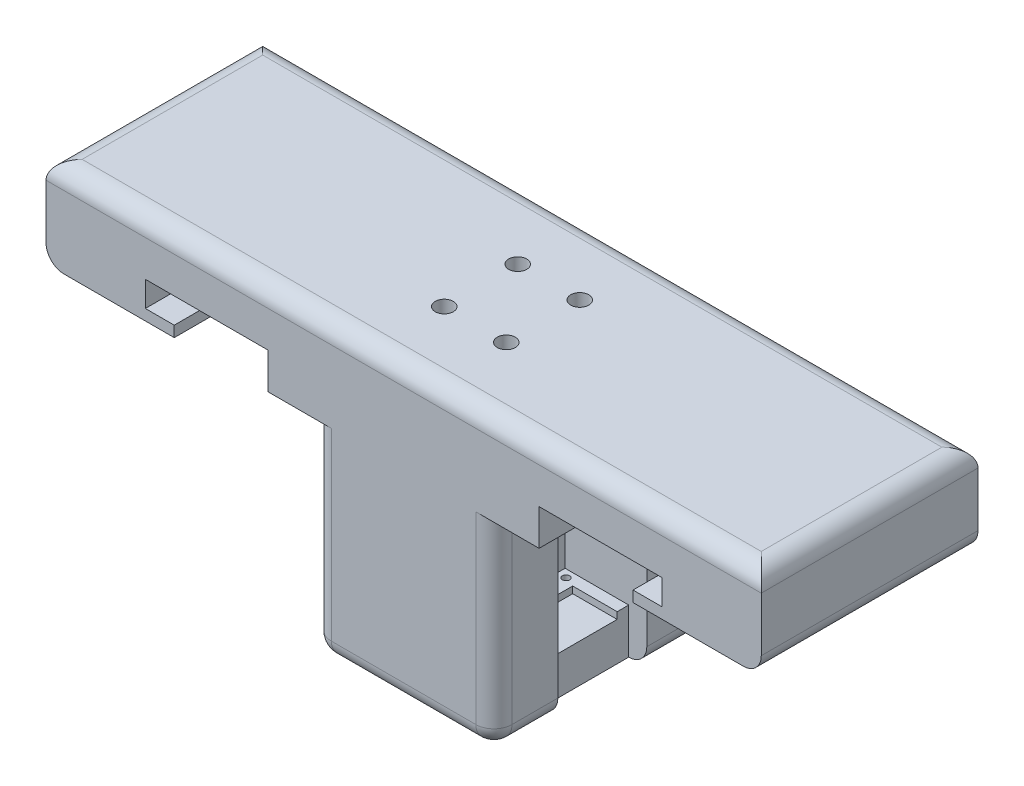
from build123d import *

# Parameters (mm, degrees)
BOSS_EXTRUDE1_DEPTH            = 30
BOSS_EXTRUDE1_DEPTH_BACK       = 30
CUT_REVOLVE2_START             = 59
CUT_REVOLVE2_DEPTH             = 7
CUT_REVOLVE2_START_2           = 56
CUT_REVOLVE2_2_DEPTH           = 3
CUT_EXTRUDE1_DEPTH             = 22.615
CUT_EXTRUDE2_REACH             = 143.287
CUT_EXTRUDE2_DIRECTION_2_DEPTH = 142.286942072
FILLET5_R                      = 5
FILLET6_R                      = 5
SKETCH7_W                      = 18.23
SKETCH7_H                      = 1.85
CUT_EXTRUDE3_DEPTH             = 17.32
SKETCH8_W                      = 20
SKETCH8_H                      = 24.63
CUT_EXTRUDE4_DEPTH             = 15.3
CUT_EXTRUDE5_REACH             = 133.385
SKETCH10_R                     = 1
SKETCH12_R                     = 2.5
CUT_EXTRUDE6_DEPTH             = 10.5
CUT_EXTRUDE7_REACH             = 133.385
SKETCH13_R                     = 1
SKETCH14_R                     = 2.5
CUT_EXTRUDE8_DEPTH             = 34.5


# Read off the part's stored shape, not the designer's step: Cut-Revolve2
with BuildPart() as part:
    # Sketch1 → Boss-Extrude1 (new, two sides: drawn at the far end of the back side and taken through both)
    with BuildSketch(Plane.XY.offset(-BOSS_EXTRUDE1_DEPTH_BACK)):
        Polygon((-25, 0), (-25, 56), (-99, 56), (-99, 81), (99, 81), (99, 56), (25, 56), (25, 0), align=None)
    extrude(amount=BOSS_EXTRUDE1_DEPTH + BOSS_EXTRUDE1_DEPTH_BACK)

    # Cut-Revolve2 outline → Cut-Revolve2 (cut)
    with BuildSketch(Plane(origin=(0, 0, 0), x_dir=(1, 0, 0), z_dir=(0, 1, 0)).offset(CUT_REVOLVE2_START)):
        with BuildLine():
            ThreePointArc((-37.5, -6), (-43.043277195, -2.296100594), (-41.742640687, 4.242640687))
            Line((-41.742640687, 4.242640687), (-61.54163056, 24.04163056))
            ThreePointArc((-61.54163056, 24.04163056), (-71.129711609, -5.004247907), (-53.5, -30))
            Line((-53.5, -30), (-37.5, -30))
            Line((-37.5, -30), (-37.5, -6))
        make_face()
    cut_revolve2 = extrude(amount=CUT_REVOLVE2_DEPTH, mode=Mode.SUBTRACT)

    # Cut-Revolve2 2 outline → Cut-Revolve2 2 (cut)
    with BuildSketch(Plane(origin=(0, 0, 0), x_dir=(1, 0, 0), z_dir=(0, 1, 0)).offset(CUT_REVOLVE2_START_2)):
        with BuildLine():
            Line((-37.5, -26), (-37.5, -14))
            ThreePointArc((-37.5, -14), (-50.434313455, -5.357568053), (-47.399494937, 9.899494937))
            Line((-47.399494937, 9.899494937), (-55.884776311, 18.384776311))
            ThreePointArc((-55.884776311, 18.384776311), (-61.520867845, -9.949769241), (-37.5, -26))
        make_face()
    cut_revolve2_2 = extrude(amount=CUT_REVOLVE2_2_DEPTH, mode=Mode.SUBTRACT)

    # Sketch4 → Cut-Extrude1 (cut)
    with BuildSketch(Plane.ZY.offset(25)):
        Polygon((12.315, 12.5), (-12.315, 12.5), (-12.315, 44.5), (-6.965, 44.5), (-6.965, 45.65), (7.015, 45.65), (7.015, 44.5), (12.315, 44.5), align=None)
    cut_extrude1 = extrude(amount=-CUT_EXTRUDE1_DEPTH, mode=Mode.SUBTRACT)

    # Mirror1: Cut-Extrude1 across plane
    add(cut_extrude1.mirror(Plane.ZY), mode=Mode.SUBTRACT)

    # Sketch5 → Cut-Extrude2 (cut, up to next)
    with BuildSketch(Plane.XY.offset(30), mode=Mode.PRIVATE) as cut_extrude2_sk1:
        Polygon((-63.5, 56), (-37.5, 56), (-37.5, 66), (-71.5, 66), (-71.5, 59), (-63.5, 59), align=None)
    cut_extrude2_tool1 = extrude(cut_extrude2_sk1.sketch, amount=-CUT_EXTRUDE2_REACH, mode=Mode.PRIVATE) & part.part
    cut_extrude2 = cut_extrude2_tool1.solids().sort_by_distance((-53.512658, 61.265823, 30))[0]
    add(cut_extrude2, mode=Mode.SUBTRACT)

    # Sketch5 → Cut-Extrude2 direction 2 (cut)
    with BuildSketch(Plane.XY.offset(30)):
        Polygon((-63.5, 56), (-37.5, 56), (-37.5, 66), (-71.5, 66), (-71.5, 59), (-63.5, 59), align=None)
    cut_extrude2_direction_2 = extrude(amount=CUT_EXTRUDE2_DIRECTION_2_DEPTH, mode=Mode.SUBTRACT)

    # Mirror4: Cut-Revolve2, Cut-Revolve2 2 across plane
    add(cut_revolve2.mirror(Plane.ZY), mode=Mode.SUBTRACT)
    add(cut_revolve2_2.mirror(Plane.ZY), mode=Mode.SUBTRACT)

    # Mirror2: Cut-Extrude2, Cut-Extrude2 direction 2 across plane
    add(cut_extrude2.mirror(Plane.ZY), mode=Mode.SUBTRACT)
    add(cut_extrude2_direction_2.mirror(Plane.ZY), mode=Mode.SUBTRACT)

    # Fillet5
    fillet5_edges = [part.edges().sort_by_distance(p)[0] for p in [
        (-99, 81, 0),
        (99, 81, 0),
        (0, 81, -30),
        (0, 81, 30),
    ]]
    fillet(fillet5_edges, radius=FILLET5_R)

    # Fillet6
    fillet6_edges = [part.edges().sort_by_distance(p)[0] for p in [
        (-25, 0, 0),
        (-99, 56, 0),
        (99, 56, 0),
        (25, 0, 0),
        (0, 0, 30),
        (25, 28, 30),
        (-25, 28, 30),
        (-25, 28, -30),
        (0, 0, -30),
        (25, 28, -30),
    ]]
    fillet(fillet6_edges, radius=FILLET6_R)

    # Sketch7 → Cut-Extrude3 (cut)
    with BuildSketch(Plane.ZY.offset(25)):
        with Locations((0, 11.575)):
            Rectangle(SKETCH7_W, SKETCH7_H)
    cut_extrude3 = extrude(amount=-CUT_EXTRUDE3_DEPTH, mode=Mode.SUBTRACT)

    # Mirror5: Cut-Extrude3 across plane
    add(cut_extrude3.mirror(Plane.ZY), mode=Mode.SUBTRACT)

    # Sketch8 → Cut-Extrude4 (cut)
    with BuildSketch(Plane.XZ):
        with Locations((-30, 0)):
            Rectangle(SKETCH8_W, SKETCH8_H)
        with Locations((30, 0)):
            Rectangle(SKETCH8_W, SKETCH8_H)
    extrude(amount=-CUT_EXTRUDE4_DEPTH, mode=Mode.SUBTRACT)

    # Sketch10 → Cut-Extrude5 (cut, up to next)
    with BuildSketch(Plane(origin=(0, 0, 0), x_dir=(-1, 0, 0), z_dir=(0, -1, 0)), mode=Mode.PRIVATE) as cut_extrude5_sk1:
        with Locations(Location((4.785, -10.165, 0), (0, 0, 90))):
            Circle(SKETCH10_R)
    cut_extrude5_tool1 = extrude(cut_extrude5_sk1.sketch, amount=-CUT_EXTRUDE5_REACH, mode=Mode.PRIVATE) & part.part
    # Sketch10 → Cut-Extrude5 (cut, up to next)
    with BuildSketch(Plane(origin=(0, 0, 0), x_dir=(-1, 0, 0), z_dir=(0, -1, 0)), mode=Mode.PRIVATE) as cut_extrude5_sk2:
        with Locations(Location((4.785, 10.165, 0), (0, 0, 180))):
            Circle(SKETCH10_R)
    cut_extrude5_tool2 = extrude(cut_extrude5_sk2.sketch, amount=-CUT_EXTRUDE5_REACH, mode=Mode.PRIVATE) & part.part
    # Sketch10 → Cut-Extrude5 (cut, up to next)
    with BuildSketch(Plane(origin=(0, 0, 0), x_dir=(-1, 0, 0), z_dir=(0, -1, 0)), mode=Mode.PRIVATE) as cut_extrude5_sk3:
        with Locations(Location((-4.785, 10.165, 0), (0, 0, 90))):
            Circle(SKETCH10_R)
    cut_extrude5_tool3 = extrude(cut_extrude5_sk3.sketch, amount=-CUT_EXTRUDE5_REACH, mode=Mode.PRIVATE) & part.part
    # Sketch10 → Cut-Extrude5 (cut, up to next)
    with BuildSketch(Plane(origin=(0, 0, 0), x_dir=(-1, 0, 0), z_dir=(0, -1, 0)), mode=Mode.PRIVATE) as cut_extrude5_sk4:
        with Locations((-4.785, -10.165)):
            Circle(SKETCH10_R)
    cut_extrude5_tool4 = extrude(cut_extrude5_sk4.sketch, amount=-CUT_EXTRUDE5_REACH, mode=Mode.PRIVATE) & part.part
    add(cut_extrude5_tool1.solids().sort_by_distance((-4.785, 0, 10.165))[0], mode=Mode.SUBTRACT)
    add(cut_extrude5_tool2.solids().sort_by_distance((-4.785, 0, -10.165))[0], mode=Mode.SUBTRACT)
    add(cut_extrude5_tool3.solids().sort_by_distance((4.785, 0, -10.165))[0], mode=Mode.SUBTRACT)
    add(cut_extrude5_tool4.solids().sort_by_distance((4.785, 0, 10.165))[0], mode=Mode.SUBTRACT)

    # Sketch12 → Cut-Extrude6 (cut)
    with BuildSketch(Plane.XZ):
        with Locations(Location((-4.785, 10.165, 0), (0, 0, 270))):
            Circle(SKETCH12_R)
        with Locations((-4.785, -10.165)):
            Circle(SKETCH12_R)
        with Locations(Location((4.785, -10.165, 0), (0, 0, 270))):
            Circle(SKETCH12_R)
        with Locations((4.785, 10.165)):
            Circle(SKETCH12_R)
    extrude(amount=-CUT_EXTRUDE6_DEPTH, mode=Mode.SUBTRACT)

    # Sketch13 → Cut-Extrude7 (cut, up to next)
    with BuildSketch(Plane(origin=(0, 81, 0), x_dir=(1, 0, 0), z_dir=(0, 1, 0)), mode=Mode.PRIVATE) as cut_extrude7_sk1:
        with Locations(Location((-8.585, 10.165, 0), (0, 0, 270))):
            Circle(SKETCH13_R)
    cut_extrude7_tool1 = extrude(cut_extrude7_sk1.sketch, amount=-CUT_EXTRUDE7_REACH, mode=Mode.PRIVATE) & part.part
    # Sketch13 → Cut-Extrude7 (cut, up to next)
    with BuildSketch(Plane(origin=(0, 81, 0), x_dir=(1, 0, 0), z_dir=(0, 1, 0)), mode=Mode.PRIVATE) as cut_extrude7_sk2:
        with Locations(Location((-8.585, -10.165, 0), (0, 0, 180))):
            Circle(SKETCH13_R)
    cut_extrude7_tool2 = extrude(cut_extrude7_sk2.sketch, amount=-CUT_EXTRUDE7_REACH, mode=Mode.PRIVATE) & part.part
    # Sketch13 → Cut-Extrude7 (cut, up to next)
    with BuildSketch(Plane(origin=(0, 81, 0), x_dir=(1, 0, 0), z_dir=(0, 1, 0)), mode=Mode.PRIVATE) as cut_extrude7_sk3:
        with Locations(Location((8.585, -10.165, 0), (0, 0, 270))):
            Circle(SKETCH13_R)
    cut_extrude7_tool3 = extrude(cut_extrude7_sk3.sketch, amount=-CUT_EXTRUDE7_REACH, mode=Mode.PRIVATE) & part.part
    # Sketch13 → Cut-Extrude7 (cut, up to next)
    with BuildSketch(Plane(origin=(0, 81, 0), x_dir=(1, 0, 0), z_dir=(0, 1, 0)), mode=Mode.PRIVATE) as cut_extrude7_sk4:
        with Locations((8.585, 10.165)):
            Circle(SKETCH13_R)
    cut_extrude7_tool4 = extrude(cut_extrude7_sk4.sketch, amount=-CUT_EXTRUDE7_REACH, mode=Mode.PRIVATE) & part.part
    add(cut_extrude7_tool1.solids().sort_by_distance((-8.585, 81, -10.165))[0], mode=Mode.SUBTRACT)
    add(cut_extrude7_tool2.solids().sort_by_distance((-8.585, 81, 10.165))[0], mode=Mode.SUBTRACT)
    add(cut_extrude7_tool3.solids().sort_by_distance((8.585, 81, 10.165))[0], mode=Mode.SUBTRACT)
    add(cut_extrude7_tool4.solids().sort_by_distance((8.585, 81, -10.165))[0], mode=Mode.SUBTRACT)

    # Sketch14 → Cut-Extrude8 (cut)
    with BuildSketch(Plane(origin=(0, 81, 0), x_dir=(1, 0, 0), z_dir=(0, 1, 0))):
        with Locations(Location((-8.585, 10.165, 0), (0, 0, 270))):
            Circle(SKETCH14_R)
        with Locations(Location((-8.585, -10.165, 0), (0, 0, 180))):
            Circle(SKETCH14_R)
        with Locations(Location((8.585, -10.165, 0), (0, 0, 270))):
            Circle(SKETCH14_R)
        with Locations(Location((8.585, 10.165, 0), (0, 0, 180))):
            Circle(SKETCH14_R)
    extrude(amount=-CUT_EXTRUDE8_DEPTH, mode=Mode.SUBTRACT)


solid = part.part
